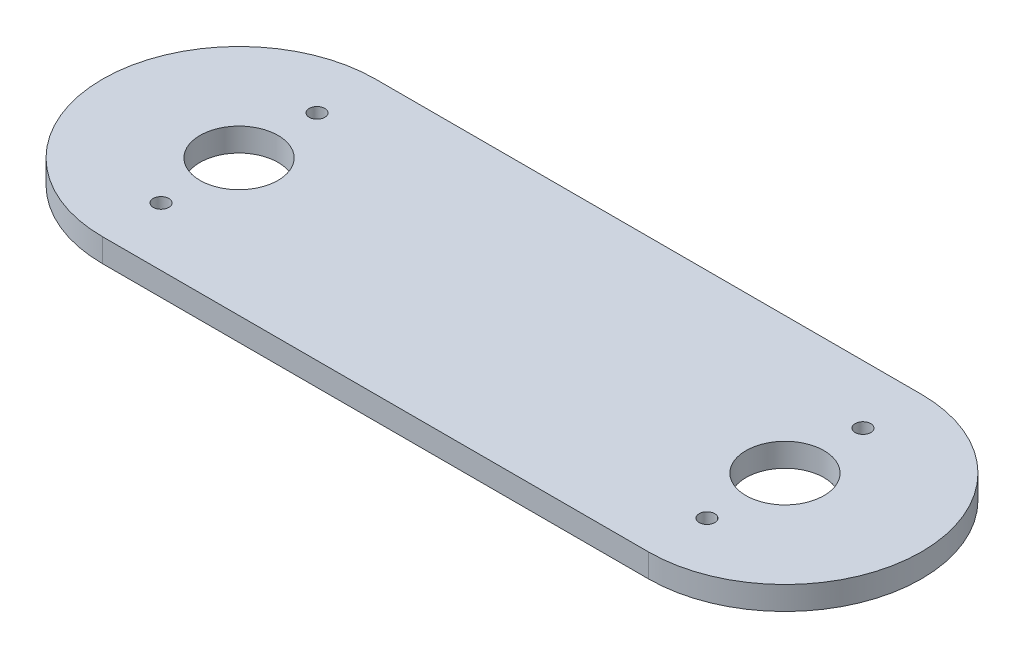
from build123d import *

# Parameters (mm, degrees)
BOSS_EXTRUDE1_DEPTH = 3
SKETCH2_R           = 5
SKETCH2_R_2         = 1
CUT_EXTRUDE1_DEPTH  = 66.706342393


with BuildPart() as part:
    # Sketch1 → Boss-Extrude1 (new body)
    with BuildSketch(Plane(origin=(0, 0, 0), x_dir=(1, 0, 0), z_dir=(0, 1, 0))):
        with BuildLine():
            Line((-31.972318339, 0), (38.027681661, 0))
            ThreePointArc((38.027681661, 0), (55.527681661, -17.5), (38.027681661, -35))
            Line((38.027681661, -35), (-31.972318339, -35))
            ThreePointArc((-31.972318339, -35), (-49.472318339, -17.5), (-31.972318339, 0))
        make_face()
    extrude(amount=BOSS_EXTRUDE1_DEPTH)

    # Sketch2 → Cut-Extrude1 (cut, through all)
    with BuildSketch(Plane(origin=(0, 3, 0), x_dir=(1, 0, 0), z_dir=(0, 1, 0))):
        with Locations((-31.972318339, -17.5)):
            Circle(SKETCH2_R)
        with Locations((-31.972318339, -7.5)):
            Circle(SKETCH2_R_2)
        with Locations((-31.972318339, -27.5)):
            Circle(SKETCH2_R_2)
        with Locations((38.027681661, -7.5)):
            Circle(SKETCH2_R_2)
        with Locations((38.027681661, -17.5)):
            Circle(SKETCH2_R)
        with Locations((38.027681661, -27.5)):
            Circle(SKETCH2_R_2)
    extrude(amount=-CUT_EXTRUDE1_DEPTH, mode=Mode.SUBTRACT)


solid = part.part
